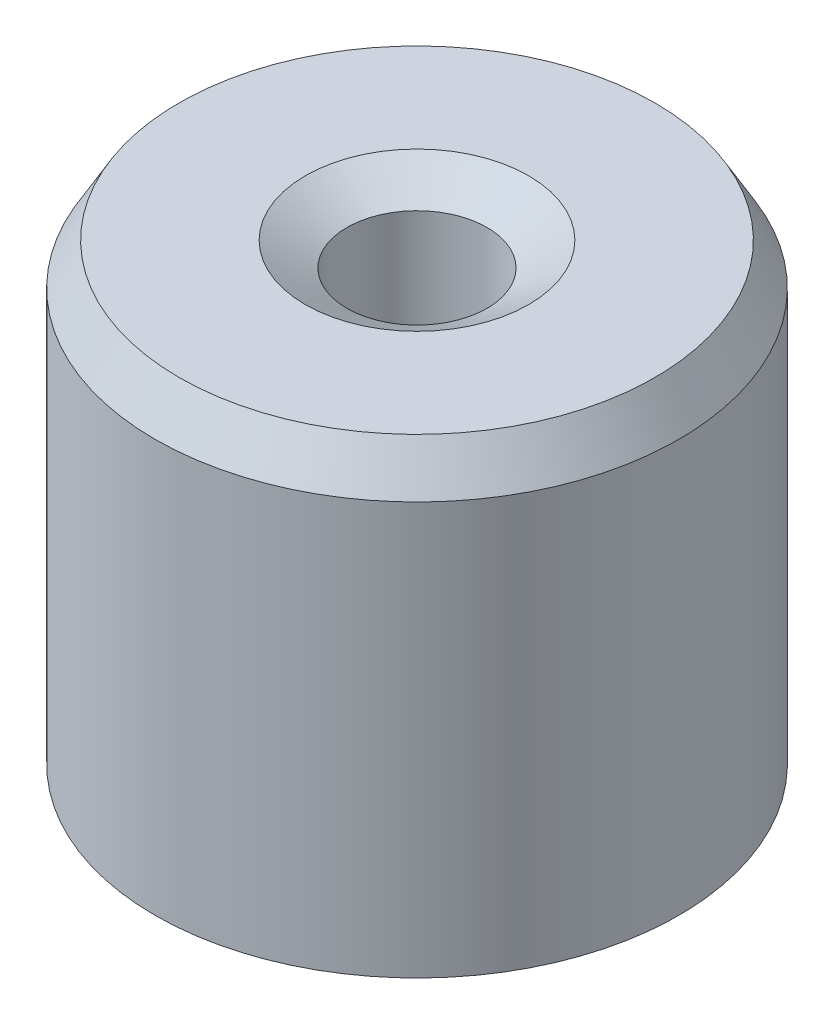
from build123d import *
from OCP.BRepFilletAPI import BRepFilletAPI_MakeChamfer

# Parameters (mm, degrees)
SKETCH1_R           = 5
BOSS_EXTRUDE1_DEPTH = 9.123098358
SKETCH2_R           = 1.337995766
CUT_EXTRUDE1_DEPTH  = 12.542570063
CHAMFER1_SIZE       = 0.793758433
CHAMFER1_SIZE2      = 0.458276645


with BuildPart() as part:
    # Sketch1 → Boss-Extrude1 (new body)
    with BuildSketch(Plane(origin=(0, 0, 0), x_dir=(1, 0, 0), z_dir=(0, 1, 0))):
        Circle(SKETCH1_R)
    extrude(amount=BOSS_EXTRUDE1_DEPTH)

    # Sketch2 → Cut-Extrude1 (cut, through all)
    with BuildSketch(Plane(origin=(0, 0, 0), x_dir=(1, 0, 0), z_dir=(0, 1, 0))):
        Circle(SKETCH2_R)
    extrude(amount=CUT_EXTRUDE1_DEPTH, mode=Mode.SUBTRACT)

    # Chamfer1: one chamfer whose edges measure the first distance from different faces: ONE call of the kernel's chamfer builder (chamfer() names one face for all edges)
    chamfer1_edges_1 = [part.edges().sort_by_distance(p)[0] for p in [
        (-1.337995766, 9.123098358, 0),
    ]]
    chamfer1_side_1 = [part.faces().sort_by_distance(p)[0] for p in [
        (-4.858578644, 9.123098358, 0),
    ]]
    chamfer1_edges_2 = [part.edges().sort_by_distance(p)[0] for p in [
        (-1.337995766, 0, 0),
    ]]
    chamfer1_side_2 = [part.faces().sort_by_distance(p)[0] for p in [
        (-1.337995766, 4.561549179, 0),
    ]]
    chamfer1_edges_3 = [part.edges().sort_by_distance(p)[0] for p in [
        (-5, 0, 0),
    ]]
    chamfer1_side_3 = [part.faces().sort_by_distance(p)[0] for p in [
        (-4.858578644, 0, 0),
    ]]
    chamfer1_edges_4 = [part.edges().sort_by_distance(p)[0] for p in [
        (-5, 9.123098358, 0),
    ]]
    chamfer1_side_4 = [part.faces().sort_by_distance(p)[0] for p in [
        (-5, 4.561549179, 0),
    ]]
    chamfer1 = BRepFilletAPI_MakeChamfer(part.part.solid().wrapped)
    for e in chamfer1_edges_1:
        chamfer1.Add(CHAMFER1_SIZE, CHAMFER1_SIZE2, e.wrapped, chamfer1_side_1[0].wrapped)  # the first distance lies on this face
    for e in chamfer1_edges_2:
        chamfer1.Add(CHAMFER1_SIZE, CHAMFER1_SIZE2, e.wrapped, chamfer1_side_2[0].wrapped)  # the first distance lies on this face
    for e in chamfer1_edges_3:
        chamfer1.Add(CHAMFER1_SIZE, CHAMFER1_SIZE2, e.wrapped, chamfer1_side_3[0].wrapped)  # the first distance lies on this face
    for e in chamfer1_edges_4:
        chamfer1.Add(CHAMFER1_SIZE, CHAMFER1_SIZE2, e.wrapped, chamfer1_side_4[0].wrapped)  # the first distance lies on this face
    add(Compound.cast(chamfer1.Shape()), mode=Mode.REPLACE)


solid = part.part
